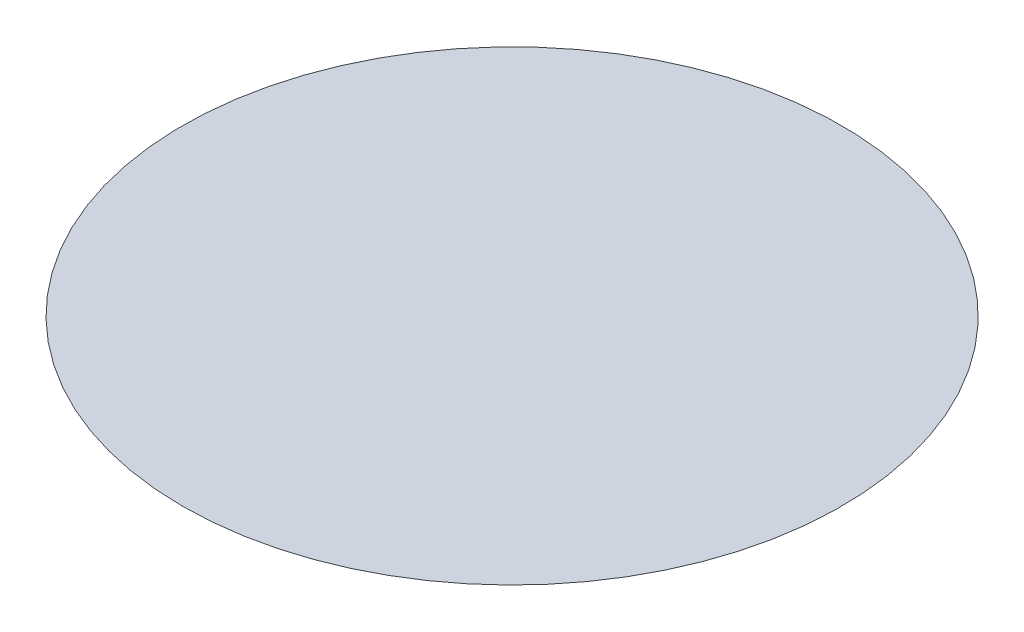
from build123d import *

# Parameters (mm, degrees)
SKETCH1_W          = 41.300685546
SKETCH1_H          = 2
BASE_EXTRUDE_DEPTH = 25
FILLET1_R          = 10
SKETCH4_W          = 50
SKETCH4_H          = 2
CUT_EXTRUDE1_DEPTH = 49.536034447


with BuildPart() as part:
    # Sketch1 → Base-Extrude (new, symmetric)
    with BuildSketch(Plane.XY):
        with Locations((0, 1)):
            Rectangle(SKETCH1_W, SKETCH1_H)
    extrude(amount=BASE_EXTRUDE_DEPTH, both=True)

    # Sketch5 → Boss-Revolve1 (revolve)
    with BuildSketch(Plane.XY):
        with BuildLine():
            Line((16.583123952, 0), (0, 0))
            Line((0, 0), (0, -5))
            ThreePointArc((0, -5), (8.660254038, -3.722813233), (16.583123952, 0))
        make_face()
    revolve(axis=Axis((0, 10.161735073, 0), (0, -1, 0)))

    # Fillet1
    fillet1_edges = [part.edges().sort_by_distance(p)[0] for p in [
        (-16.583123952, 0, 0),
    ]]
    fillet(fillet1_edges, radius=FILLET1_R)

    # Sketch4 → Cut-Extrude1 (cut, through all)
    with BuildSketch(Plane(origin=(20.650342773, 0, 0), x_dir=(0, 0, -1), z_dir=(1, 0, 0))):
        with Locations((0, 1)):
            Rectangle(SKETCH4_W, SKETCH4_H)
    extrude(amount=-CUT_EXTRUDE1_DEPTH, mode=Mode.SUBTRACT)


solid = part.part
